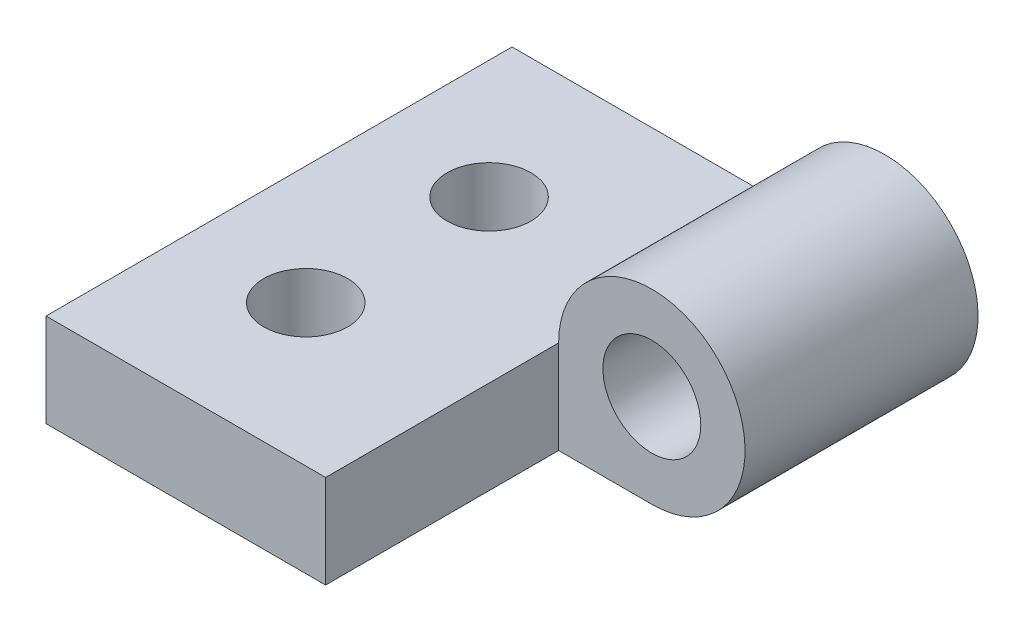
from build123d import *

# Parameters (mm, degrees)
SKETCH1_R           = 2.667
BOSS_EXTRUDE1_DEPTH = 25.4
CUT_EXTRUDE1_START  = -12.7
CUT_EXTRUDE1_DEPTH  = 12.7
SKETCH3_R           = 2.286
CUT_EXTRUDE2_DEPTH  = 37.278456417


with BuildPart() as part:
    # Sketch1 → Boss-Extrude1 (new body)
    with BuildSketch(Plane.XY):
        with BuildLine():
            Line((0, 5.08), (15.24, 5.08))
            ThreePointArc((15.24, 5.08), (23.912102448, 8.672102448), (20.32, 0))
            Line((20.32, 0), (0, 0))
            Line((0, 0), (0, 5.08))
        make_face()
        with Locations((20.32, 5.08)):
            Circle(SKETCH1_R, mode=Mode.SUBTRACT)
    extrude(amount=BOSS_EXTRUDE1_DEPTH)

    # Sketch2 → Cut-Extrude1 (cut)
    with BuildSketch(Plane.XY.offset(25.4).offset(CUT_EXTRUDE1_START)):
        with BuildLine():
            Line((15.24, 10.16), (15.24, 0))
            Line((15.24, 0), (20.32, 0))
            ThreePointArc((20.32, 0), (25.4, 5.08), (20.32, 10.16))
            Line((20.32, 10.16), (15.24, 10.16))
        make_face()
    extrude(amount=CUT_EXTRUDE1_DEPTH, mode=Mode.SUBTRACT)

    # Sketch3 → Cut-Extrude2 (cut, through all)
    with BuildSketch(Plane(origin=(0, 5.08, 0), x_dir=(1, 0, 0), z_dir=(0, 1, 0))):
        with Locations((6.4516, -7.704666667)):
            Circle(SKETCH3_R)
        with Locations((6.4516, -17.695333333)):
            Circle(SKETCH3_R)
    extrude(amount=-CUT_EXTRUDE2_DEPTH, mode=Mode.SUBTRACT)


solid = part.part
